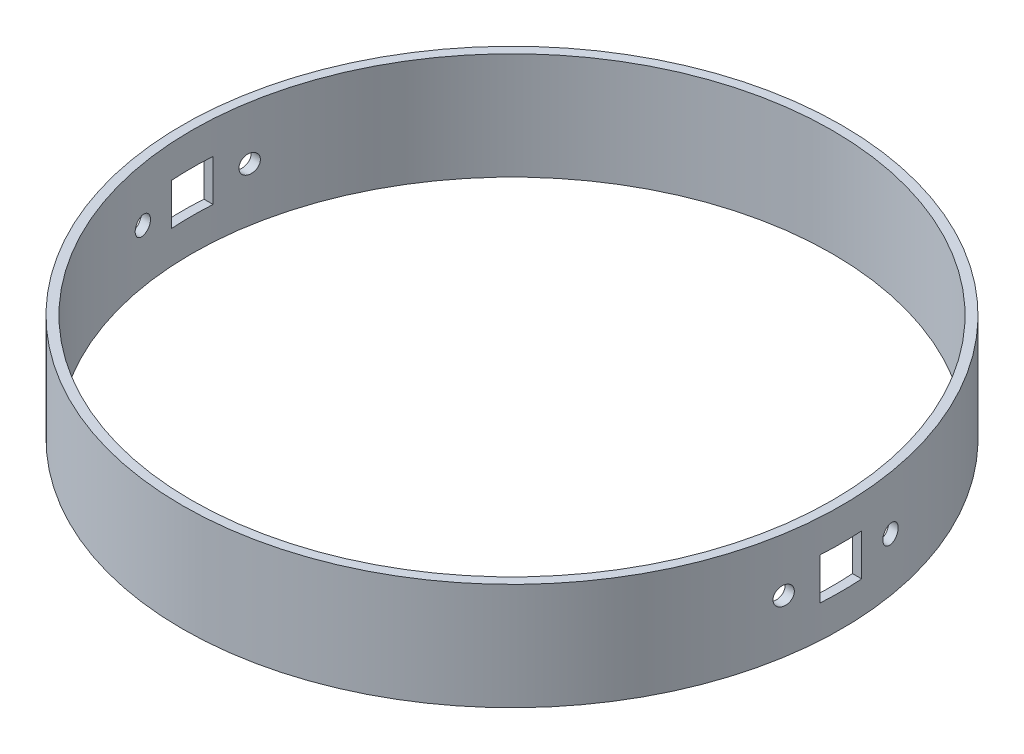
from build123d import *

# Parameters (mm, degrees)
SKETCH1_R                                    = 78.359
SKETCH1_R_2                                  = 76.1746
BOSS_EXTRUDE1_DEPTH                          = 25.4
SKETCH2_W                                    = 9.906
SKETCH2_H                                    = 9.906
SKETCH2_R                                    = 2.18313
CUT_EXTRUDE1_DEPTH                           = 114.690042493
MIRROR2_AT_THE_SECOND_PLANE_COPY_1_SKETC_R   = 78.359
MIRROR2_AT_THE_SECOND_PLANE_COPY_1_SKETC_R_2 = 76.1746
MIRROR2_AT_THE_SECOND_PLANE_COPY_1_DEPTH     = 25.4
MIRROR2_AT_THE_SECOND_PLANE_COPY_2_SKETC_W   = 9.906
MIRROR2_AT_THE_SECOND_PLANE_COPY_2_SKETC_H   = 9.906
MIRROR2_AT_THE_SECOND_PLANE_COPY_2_SKETC_R   = 2.18313
MIRROR2_AT_THE_SECOND_PLANE_COPY_2_DEPTH     = 114.690042493


with BuildPart() as part:
    # Sketch1 → Boss-Extrude1 (new body)
    with BuildSketch(Plane(origin=(0, 0, 0), x_dir=(1, 0, 0), z_dir=(0, 1, 0))):
        Circle(SKETCH1_R)
        Circle(SKETCH1_R_2, mode=Mode.SUBTRACT)
    boss_extrude1 = extrude(amount=BOSS_EXTRUDE1_DEPTH)

    # Sketch2 → Cut-Extrude1 (cut, symmetric)
    with BuildSketch(Plane(origin=(0, 0, 0), x_dir=(0, 0, -1), z_dir=(1, 0, 0))):
        with Locations((0, 12.7)):
            Rectangle(SKETCH2_W, SKETCH2_H)
        with Locations((-12.7, 12.7)):
            Circle(SKETCH2_R)
        with Locations((12.7, 12.7)):
            Circle(SKETCH2_R)
    cut_extrude1 = extrude(amount=CUT_EXTRUDE1_DEPTH, both=True, mode=Mode.SUBTRACT)

    # Mirror2: Boss-Extrude1, Cut-Extrude1 across plane
    add(boss_extrude1.mirror(Plane(origin=(0, 0, 0), x_dir=(0, 0, 1), z_dir=(1, 0, 0))))
    add(cut_extrude1.mirror(Plane(origin=(0, 0, 0), x_dir=(0, 0, 1), z_dir=(1, 0, 0))), mode=Mode.SUBTRACT)

    # Mirror2 at the second plane: Boss-Extrude1, Cut-Extrude1 across plane
    add(boss_extrude1.mirror(Plane.ZX.offset(12.7)))
    add(cut_extrude1.mirror(Plane.ZX.offset(12.7)), mode=Mode.SUBTRACT)

    # Mirror2 at the second plane copy 1 sketc → Mirror2 at the second plane copy 1 (add)
    with BuildSketch(Plane(origin=(0, 25.4, 0), x_dir=(-1, 0, 0), z_dir=(0, -1, 0))):
        Circle(MIRROR2_AT_THE_SECOND_PLANE_COPY_1_SKETC_R)
        Circle(MIRROR2_AT_THE_SECOND_PLANE_COPY_1_SKETC_R_2, mode=Mode.SUBTRACT)
    extrude(amount=MIRROR2_AT_THE_SECOND_PLANE_COPY_1_DEPTH)

    # Mirror2 at the second plane copy 2 sketc → Mirror2 at the second plane copy 2 (cut, symmetric)
    with BuildSketch(Plane(origin=(0, 25.4, 0), x_dir=(0, 0, -1), z_dir=(-1, 0, 0))):
        with Locations((0, 12.7)):
            Rectangle(MIRROR2_AT_THE_SECOND_PLANE_COPY_2_SKETC_W, MIRROR2_AT_THE_SECOND_PLANE_COPY_2_SKETC_H)
        with Locations((-12.7, 12.7)):
            Circle(MIRROR2_AT_THE_SECOND_PLANE_COPY_2_SKETC_R)
        with Locations((12.7, 12.7)):
            Circle(MIRROR2_AT_THE_SECOND_PLANE_COPY_2_SKETC_R)
    extrude(amount=MIRROR2_AT_THE_SECOND_PLANE_COPY_2_DEPTH, both=True, mode=Mode.SUBTRACT)


solid = part.part
